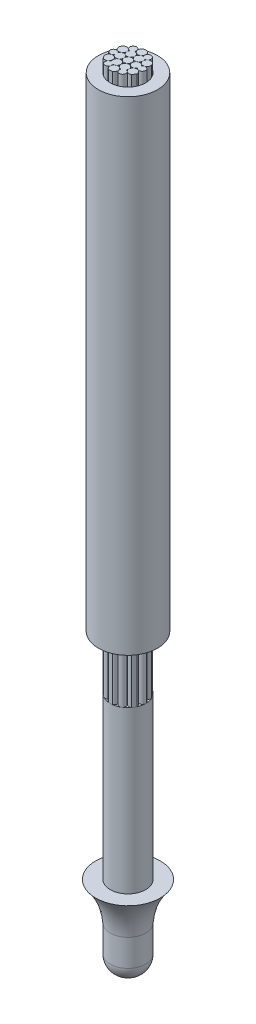
from build123d import *

# Parameters (mm, degrees)
EXTRUDE_2_OUTLINE_R = 0.075
EXTRUDE_2_DEPTH     = 10.2
EXTRUDE_2_2_DEPTH   = 10.2
EXTRUDE_2_3_DEPTH   = 10.2
EXTRUDE_2_4_DEPTH   = 10.2
EXTRUDE_2_5_DEPTH   = 10.2
EXTRUDE_2_6_DEPTH   = 10.2
EXTRUDE_2_7_DEPTH   = 10.2
EXTRUDE_2_8_DEPTH   = 10.2
EXTRUDE_2_9_DEPTH   = 10.2
EXTRUDE_2_10_DEPTH  = 10.2
EXTRUDE_2_11_DEPTH  = 10.2
EXTRUDE_2_12_DEPTH  = 10.2
EXTRUDE_2_13_DEPTH  = 10.2
EXTRUDE_5_DEPTH     = 4.5
EXTRUDE_START       = 1
SKETCH_3_R          = 0.55
SKETCH_3_R_2        = 0.33
EXTRUDE_6_DEPTH     = 9
FILLET_3_R          = 0.3


# Read off the part's stored shape, not the designer's step: Бобышка-Вытянуть2
with BuildPart() as part:
    # Бобышка-Вытянуть2 outline → Бобышка-Вытянуть2 (new body)
    with BuildSketch(Plane(origin=(0, 0, 0), x_dir=(1, 0, 0), z_dir=(0, 1, 0))):
        Circle(EXTRUDE_2_OUTLINE_R)
    extrude(amount=EXTRUDE_2_DEPTH)


with BuildPart() as body_2:
    # Extrude 2 2 outline → Extrude 2 2 (new body)
    with BuildSketch(Plane(origin=(0, 0, 0), x_dir=(1, 0, 0), z_dir=(0, 1, 0))):
        with BuildLine():
            ThreePointArc((-0.215577435, 0.031523255), (-0.329990207, -0.00229018), (-0.215577435, -0.036103616))
            ThreePointArc((-0.215577435, -0.036103616), (-0.135616584, -0.076152155), (-0.074161469, -0.011183762))
            ThreePointArc((-0.074161469, -0.011183762), (-0.074991098, -0.00115549), (-0.074470828, 0.008893581))
            ThreePointArc((-0.074470828, 0.008893581), (-0.136756085, 0.071763554), (-0.215577435, 0.031523255))
        make_face()
    extrude(amount=EXTRUDE_2_2_DEPTH)



with BuildPart() as body_3:
    # Extrude 2 3 outline → Extrude 2 3 (new body)
    with BuildSketch(Plane(origin=(0, 0, 0), x_dir=(1, 0, 0), z_dir=(0, 1, 0))):
        with BuildLine():
            ThreePointArc((-0.078416857, 0.202460861), (-0.164965898, 0.285808068), (-0.13605962, 0.169180796))
            ThreePointArc((-0.13605962, 0.169180796), (-0.132931564, 0.081694169), (-0.049012134, 0.056769805))
            ThreePointArc((-0.049012134, 0.056769805), (-0.03748264, 0.064961925), (-0.024620163, 0.070843825))
            ThreePointArc((-0.024620163, 0.070843825), (-0.004207657, 0.155990018), (-0.078416857, 0.202460861))
        make_face()
    extrude(amount=EXTRUDE_2_3_DEPTH)


with BuildPart() as body_4:
    # Extrude 2 4 outline → Extrude 2 4 (new body)
    with BuildSketch(Plane(origin=(0, 0, 0), x_dir=(1, 0, 0), z_dir=(0, 1, 0))):
        with BuildLine():
            ThreePointArc((0.139140572, 0.168657106), (0.167012389, 0.284614831), (0.080525962, 0.202498267))
            ThreePointArc((0.080525962, 0.202498267), (0.006248792, 0.154228257), (0.029790206, 0.068829817))
            ThreePointArc((0.029790206, 0.068829817), (0.038512817, 0.06435653), (0.046577497, 0.058783813))
            ThreePointArc((0.046577497, 0.058783813), (0.133726217, 0.079291783), (0.139140572, 0.168657106))
        make_face()
    extrude(amount=EXTRUDE_2_4_DEPTH)


with BuildPart() as body_5:
    # Extrude 2 5 outline → Extrude 2 5 (new body)
    with BuildSketch(Plane(origin=(0, 0, 0), x_dir=(1, 0, 0), z_dir=(0, 1, 0))):
        with BuildLine():
            ThreePointArc((0.217749972, -0.037195687), (0.329990231, -0.002290181), (0.217749972, 0.032615326))
            ThreePointArc((0.217749972, 0.032615326), (0.076367703, -0.00229018), (0.217749972, -0.037195687))
        make_face()
    extrude(amount=EXTRUDE_2_5_DEPTH)


with BuildPart() as body_6:
    # Extrude 2 6 outline → Extrude 2 6 (new body)
    with BuildSketch(Plane(origin=(0, 0, 0), x_dir=(1, 0, 0), z_dir=(0, 1, 0))):
        with BuildLine():
            ThreePointArc((0.078601287, -0.207160724), (0.164936529, -0.285825011), (0.140123873, -0.171692736))
            ThreePointArc((0.140123873, -0.171692736), (0.038908974, -0.067218275), (0.078601287, -0.207160724))
        make_face()
    extrude(amount=EXTRUDE_2_6_DEPTH)


with BuildPart() as body_7:
    # Extrude 2 7 outline → Extrude 2 7 (new body)
    with BuildSketch(Plane(origin=(0, 0, 0), x_dir=(1, 0, 0), z_dir=(0, 1, 0))):
        with BuildLine():
            ThreePointArc((-0.137069196, -0.172203487), (-0.162882691, -0.286998397), (-0.076471576, -0.207140228))
            ThreePointArc((-0.076471576, -0.207140228), (-0.036171958, -0.067219203), (-0.137069196, -0.172203487))
        make_face()
    extrude(amount=EXTRUDE_2_7_DEPTH)


with BuildPart() as body_8:
    # Extrude 2 8 outline → Extrude 2 8 (new body)
    with BuildSketch(Plane(origin=(0, 0, 0), x_dir=(1, 0, 0), z_dir=(0, 1, 0))):
        with BuildLine():
            ThreePointArc((-0.296729349, 0.144401155), (-0.158491958, 0.090441918), (-0.275270897, 0.182005311))
            ThreePointArc((-0.275270897, 0.182005311), (-0.286617495, 0.163555531), (-0.296729349, 0.144401155))
        make_face()
    extrude(amount=EXTRUDE_2_8_DEPTH)


with BuildPart() as body_9:
    # Extrude 2 9 outline → Extrude 2 9 (new body)
    with BuildSketch(Plane(origin=(0, 0, 0), x_dir=(1, 0, 0), z_dir=(0, 1, 0))):
        with BuildLine():
            ThreePointArc((-0.267830407, -0.192787118), (-0.159068831, -0.0940291), (-0.29802696, -0.141703673))
            ThreePointArc((-0.29802696, -0.141703673), (-0.284079249, -0.16792552), (-0.267830407, -0.192787118))
        make_face()
    extrude(amount=EXTRUDE_2_9_DEPTH)


with BuildPart() as body_10:
    # Extrude 2 10 outline → Extrude 2 10 (new body)
    with BuildSketch(Plane(origin=(0, 0, 0), x_dir=(1, 0, 0), z_dir=(0, 1, 0))):
        with BuildLine():
            ThreePointArc((-0.020066658, 0.329389328), (0.000969374, 0.182518498), (0.023564272, 0.329157599))
            ThreePointArc((0.023564272, 0.329157599), (0.001752641, 0.329995346), (-0.020066658, 0.329389328))
        make_face()
    extrude(amount=EXTRUDE_2_10_DEPTH)


with BuildPart() as body_11:
    # Extrude 2 11 outline → Extrude 2 11 (new body)
    with BuildSketch(Plane(origin=(0, 0, 0), x_dir=(1, 0, 0), z_dir=(0, 1, 0))):
        with BuildLine():
            ThreePointArc((0.038848965, -0.327705291), (0.000977296, -0.187743587), (-0.03543522, -0.328091977))
            ThreePointArc((-0.03543522, -0.328091977), (0.001717788, -0.329995529), (0.038848965, -0.327705291))
        make_face()
    extrude(amount=EXTRUDE_2_11_DEPTH)


with BuildPart() as body_12:
    # Extrude 2 12 outline → Extrude 2 12 (new body)
    with BuildSketch(Plane(origin=(0, 0, 0), x_dir=(1, 0, 0), z_dir=(0, 1, 0))):
        with BuildLine():
            ThreePointArc((0.301331175, -0.134534467), (0.161602494, -0.094372467), (0.265242363, -0.196332597))
            ThreePointArc((0.265242363, -0.196332597), (0.284966921, -0.166414705), (0.301331175, -0.134534467))
        make_face()
    extrude(amount=EXTRUDE_2_12_DEPTH)


with BuildPart() as body_13:
    # Extrude 2 13 outline → Extrude 2 13 (new body)
    with BuildSketch(Plane(origin=(0, 0, 0), x_dir=(1, 0, 0), z_dir=(0, 1, 0))):
        with BuildLine():
            ThreePointArc((0.271600665, 0.1874382), (0.16103432, 0.090782272), (0.300968191, 0.135344552))
            ThreePointArc((0.300968191, 0.135344552), (0.287466887, 0.162057981), (0.271600665, 0.1874382))
        make_face()
    extrude(amount=EXTRUDE_2_13_DEPTH)


with BuildPart() as body_14:
    # Эскиз2 → Бобышка-Вытянуть5 (new body)
    with BuildSketch(Plane(origin=(0, 0, 0), x_dir=(1, 0, 0), z_dir=(0, 1, 0))):
        with BuildLine():
            ThreePointArc((-0.020066658, 0.329389328), (-0.165035087, 0.285768123), (-0.275270897, 0.182005311))
            ThreePointArc((-0.275270897, 0.182005311), (-0.286617495, 0.163555531), (-0.296729349, 0.144401155))
            ThreePointArc((-0.296729349, 0.144401155), (-0.329996606, 0.00149668), (-0.29802696, -0.141703673))
            ThreePointArc((-0.29802696, -0.141703673), (-0.284079249, -0.16792552), (-0.267830407, -0.192787118))
            ThreePointArc((-0.267830407, -0.192787118), (-0.166040241, -0.285185271), (-0.03543522, -0.328091977))
            ThreePointArc((-0.03543522, -0.328091977), (0.001717788, -0.329995529), (0.038848965, -0.327705291))
            ThreePointArc((0.038848965, -0.327705291), (0.165627836, -0.285424981), (0.265242363, -0.196332597))
            ThreePointArc((0.265242363, -0.196332597), (0.284966921, -0.166414705), (0.301331175, -0.134534467))
            ThreePointArc((0.301331175, -0.134534467), (0.322753225, -0.068777584), (0.33, 0))
            ThreePointArc((0.33, 0), (0.322660428, 0.069211621), (0.300968191, 0.135344552))
            ThreePointArc((0.300968191, 0.135344552), (0.287466887, 0.162057981), (0.271600665, 0.1874382))
            ThreePointArc((0.271600665, 0.1874382), (0.163712193, 0.28652804), (0.023564272, 0.329157599))
            ThreePointArc((0.023564272, 0.329157599), (0.001752641, 0.329995346), (-0.020066658, 0.329389328))
        make_face()
    extrude(amount=-EXTRUDE_5_DEPTH)

    # Эскиз5 → Повернуть1 (revolve)
    with BuildSketch(Plane(origin=(0, 0, 0), x_dir=(-1, 0, 0), z_dir=(0, 0, 1)), mode=Mode.PRIVATE) as revolve_1_sk:
        with BuildLine():
            Line((-0.33, 3), (-0.6, 3))
            add(Edge.make_bspline(
                [(-0.33, 3.7), (-0.356057392, 3.300263602), (-0.6, 3)],
                knots=[0, 0, 0, 1, 1, 1], degree=2))
            Line((-0.33, 3.7), (0, 3.7))
            Line((0, 3.7), (0, 3))
            Line((0, 3), (-0.33, 3))
        make_face()
    revolve(revolve_1_sk.sketch.rotate(Axis((0, -3, 0), (0, -1, 0)), 90), axis=Axis((0, -3, 0), (0, -1, 0)))

    # Скругление3
    fillet_3_edges = [body_14.edges().sort_by_distance(p)[0] for p in [
        (0.29802696, -4.5, -0.141703673),
    ]]
    fillet(fillet_3_edges, radius=FILLET_3_R)


with BuildPart() as body_2_1:
    add(body_2.part)

    add(body_3.part)  # Бобышка-Вытянуть6 merges body 3

    add(body_4.part)  # Бобышка-Вытянуть6 merges body 4

    add(body_5.part)  # Бобышка-Вытянуть6 merges body 5

    add(body_6.part)  # Бобышка-Вытянуть6 merges body 6

    add(body_7.part)  # Бобышка-Вытянуть6 merges body 7

    add(body_8.part)  # Бобышка-Вытянуть6 merges body 8

    add(body_9.part)  # Бобышка-Вытянуть6 merges body 9

    add(body_10.part)  # Бобышка-Вытянуть6 merges body 10

    add(body_11.part)  # Бобышка-Вытянуть6 merges body 11

    add(body_12.part)  # Бобышка-Вытянуть6 merges body 12

    add(body_13.part)  # Бобышка-Вытянуть6 merges body 13
    # Эскиз3 → Бобышка-Вытянуть6 (add)
    with BuildSketch(Plane(origin=(0, 0, 0), x_dir=(1, 0, 0), z_dir=(0, 1, 0)).offset(EXTRUDE_START)):
        with Locations(Location((0, 0, 0), (0, 0, 270))):
            Circle(SKETCH_3_R)
        with Locations(Location((0, 0, 0), (0, 0, 270))):
            Circle(SKETCH_3_R_2, mode=Mode.SUBTRACT)
    extrude(amount=EXTRUDE_6_DEPTH)


solid = Compound([part.part, body_14.part, body_2_1.part])
